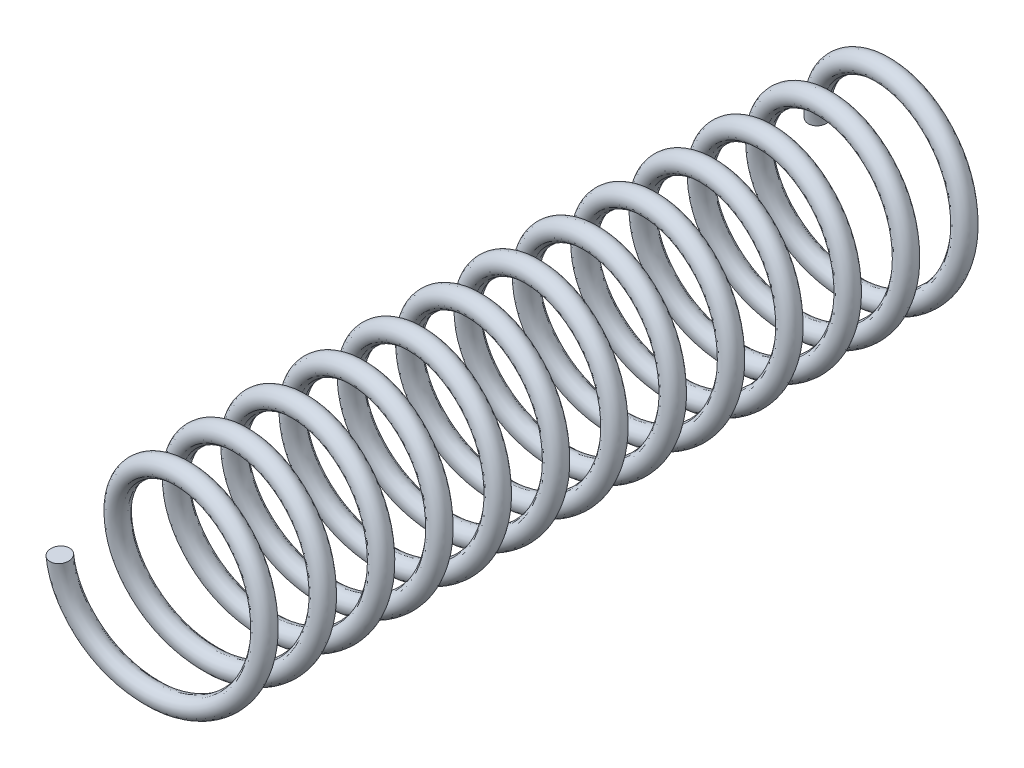
from build123d import *

# Parameters (mm, degrees)
SWEEP1_PITCH       = 1
SWEEP1_HEIGHT      = 13
SWEEP1_RADIUS      = 1.5
SWEEP1_START_ANGLE = 180
SKETCH3_R          = 0.168059846


with BuildPart() as part:
    # Sweep1: sweep along a helix
    with BuildLine() as sweep1_path:
        add(Helix(SWEEP1_PITCH, SWEEP1_HEIGHT, SWEEP1_RADIUS, center=(0, 0, 0), direction=(0, 0, 1), lefthand=True, mode=Mode.PRIVATE).rotate(Axis((0, 0, 0), (0, 0, 1)), SWEEP1_START_ANGLE))
    # Sketch3 → Sweep1 (sweep)
    with BuildSketch(Plane(origin=(-1.5, 0, 13), x_dir=(1, 0, 0), z_dir=(1.6609364731365264e-13, 0.9944181315116447, 0.10551104075351264))):
        with Locations((-0.000361503, 0.006589773)):
            Circle(SKETCH3_R)
    sweep(path=sweep1_path.line, is_frenet=True)


solid = part.part
